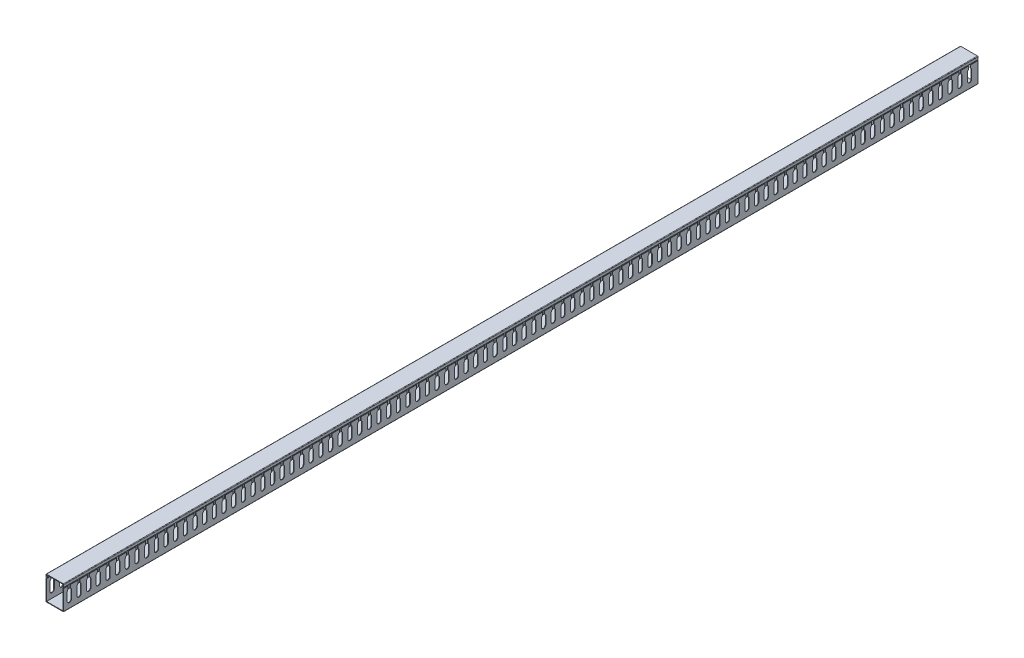
from build123d import *

# Parameters (mm, degrees)
BOSS_EXTRUDE1_DEPTH = 850
BOSS_EXTRUDE2_DEPTH = 850
CUT_EXTRUDE1_DEPTH  = 852.829795206
LPATTERN1_COUNT     = 94
LPATTERN1_PITCH     = 18


with BuildPart() as part:
    # Sketch4 → Boss-Extrude1 (new, symmetric)
    with BuildSketch(Plane.XY):
        with BuildLine():
            Line((-15.5, 37.834592439), (-15.5, 1))
            Line((-15.5, 1), (15.5, 1))
            Line((15.5, 1), (15.5, 37.834592439))
            Line((15.5, 37.834592439), (13.524103583, 40.820408077))
            ThreePointArc((13.524103583, 40.820408077), (13.36216977, 41.463091663), (13.637685416, 42.065881742))
            Line((13.637685416, 42.065881742), (15.5, 44))
            Line((15.5, 44), (15.5, 41.488652376))
            Line((15.5, 41.488652376), (14.281021763, 41.488652376))
            Line((14.281021763, 41.488652376), (16.333933618, 38.386457205))
            ThreePointArc((16.333933618, 38.386457205), (16.457583839, 38.122747242), (16.5, 37.834592439))
            Line((16.5, 37.834592439), (16.5, 1))
            ThreePointArc((16.5, 1), (16.207106781, 0.292893219), (15.5, 0))
            Line((15.5, 0), (-15.5, 0))
            ThreePointArc((-15.5, 0), (-16.207106781, 0.292893219), (-16.5, 1))
            Line((-16.5, 1), (-16.5, 37.834592439))
            ThreePointArc((-16.5, 37.834592439), (-16.457583839, 38.122747242), (-16.333933618, 38.386457205))
            Line((-16.333933618, 38.386457205), (-14.281021763, 41.488652376))
            Line((-14.281021763, 41.488652376), (-15.5, 41.488652376))
            Line((-15.5, 41.488652376), (-15.5, 44))
            Line((-15.5, 44), (-13.637685416, 42.065881742))
            ThreePointArc((-13.637685416, 42.065881742), (-13.36216977, 41.463091663), (-13.524103583, 40.820408077))
            Line((-13.524103583, 40.820408077), (-15.5, 37.834592439))
        make_face()
    extrude(amount=BOSS_EXTRUDE1_DEPTH, both=True)

    # Sketch6 → Cut-Extrude1 (cut, through all)
    with BuildSketch(Plane(origin=(16.5, 0, 0), x_dir=(0, 0, -1), z_dir=(1, 0, 0))):
        with BuildLine():
            Line((-835.65, 29), (-835.65, 14))
            ThreePointArc((-835.65, 14), (-839.65, 10), (-843.65, 14))
            Line((-843.65, 14), (-843.65, 29))
            ThreePointArc((-843.65, 29), (-843.114101615, 31), (-841.65, 32.464101615))
            Line((-841.65, 32.464101615), (-841.65, 44))
            Line((-841.65, 44), (-837.65, 44))
            Line((-837.65, 44), (-837.65, 32.464101615))
            ThreePointArc((-837.65, 32.464101615), (-836.185898385, 31), (-835.65, 29))
        make_face()
    cut_extrude1 = extrude(amount=-CUT_EXTRUDE1_DEPTH, mode=Mode.SUBTRACT)

    # LPattern1: Cut-Extrude1 ×94
    with Locations(*[(0, 0, -i * LPATTERN1_PITCH) for i in range(1, LPATTERN1_COUNT)]):
        add(cut_extrude1, mode=Mode.SUBTRACT)


with BuildPart() as body_2:
    # Sketch5 → Boss-Extrude2 (new, symmetric)
    with BuildSketch(Plane.XY):
        with BuildLine():
            Line((-14.281021763, 41.488652376), (-15.515794777, 39.622762775))
            Line((-15.515794777, 39.622762775), (-16.5, 39.622762775))
            Line((-16.5, 39.622762775), (-16.5, 44))
            ThreePointArc((-16.5, 44), (-16.207106781, 44.707106781), (-15.5, 45))
            Line((-15.5, 45), (15.5, 45))
            ThreePointArc((15.5, 45), (16.207106781, 44.707106781), (16.5, 44))
            Line((16.5, 44), (16.5, 39.622762775))
            Line((16.5, 39.622762775), (15.515794777, 39.622762775))
            Line((15.515794777, 39.622762775), (14.281021763, 41.488652376))
            Line((14.281021763, 41.488652376), (15.5, 41.488652376))
            Line((15.5, 41.488652376), (15.5, 44))
            Line((15.5, 44), (-15.5, 44))
            Line((-15.5, 44), (-15.5, 41.488652376))
            Line((-15.5, 41.488652376), (-14.281021763, 41.488652376))
        make_face()
    extrude(amount=BOSS_EXTRUDE2_DEPTH, both=True)


solid = Compound([part.part, body_2.part])
